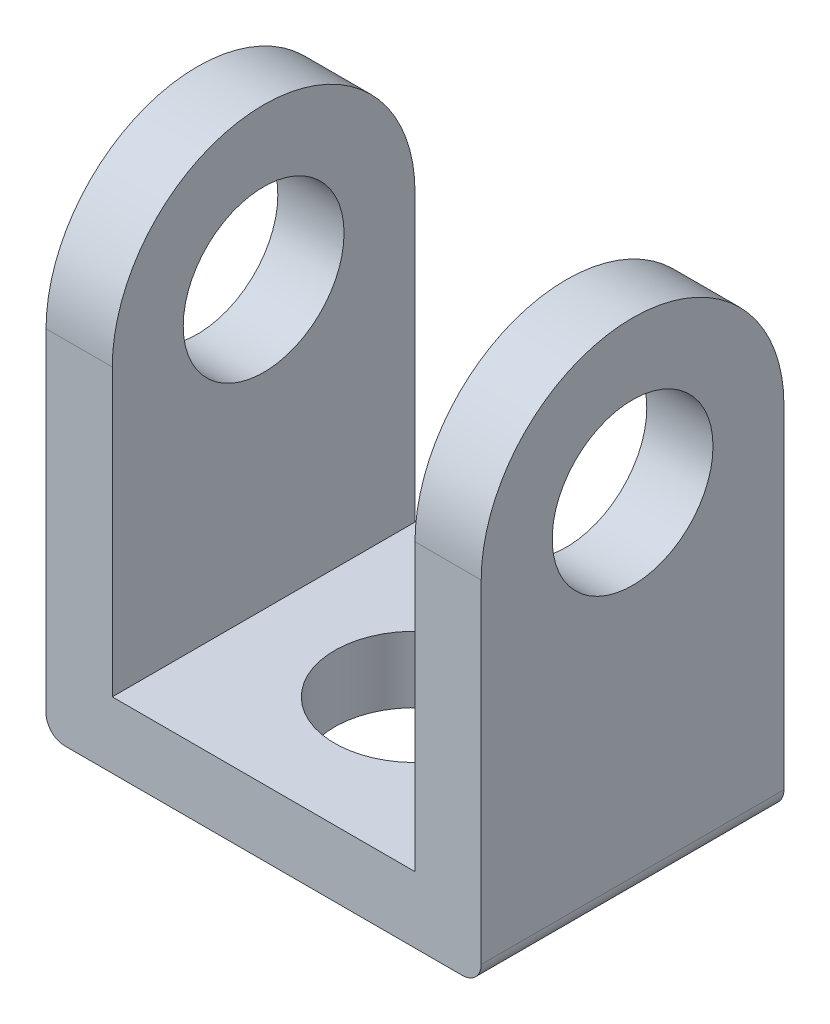
from build123d import *

# Parameters (mm, degrees)
SKETCH1_W           = 11.5
SKETCH1_H           = 8
BOSS_EXTRUDE1_DEPTH = 13.3
CUT_EXTRUDE1_REACH  = 20.032
SKETCH2_R           = 2.125
CUT_EXTRUDE2_REACH  = 20.032
CUT_EXTRUDE3_REACH  = 18.552
SKETCH4_W           = 8
SKETCH4_H           = 11.55
CUT_EXTRUDE4_REACH  = 17.032
SKETCH5_R           = 2.125
FILLET1_R           = 0.5


with BuildPart() as part:
    # Sketch1 → Boss-Extrude1 (new body)
    with BuildSketch(Plane(origin=(0, 0, 0), x_dir=(1, 0, 0), z_dir=(0, 1, 0))):
        Rectangle(SKETCH1_W, SKETCH1_H)
    extrude(amount=BOSS_EXTRUDE1_DEPTH)

    # Sketch2 → Cut-Extrude1 (cut, up to next)
    with BuildSketch(Plane(origin=(5.75, 0, 0), x_dir=(0, 0, -1), z_dir=(1, 0, 0)), mode=Mode.PRIVATE) as cut_extrude1_sk1:
        with Locations((0, 9.3)):
            Circle(SKETCH2_R)
    cut_extrude1_tool1 = extrude(cut_extrude1_sk1.sketch, amount=-CUT_EXTRUDE1_REACH, mode=Mode.PRIVATE) & part.part
    add(cut_extrude1_tool1.solids().sort_by_distance((5.75, 9.3, 0))[0], mode=Mode.SUBTRACT)

    # Sketch3 → Cut-Extrude2 (cut, up to next)
    with BuildSketch(Plane(origin=(5.75, 0, 0), x_dir=(0, 0, -1), z_dir=(1, 0, 0)), mode=Mode.PRIVATE) as cut_extrude2_sk1:
        with BuildLine():
            Line((0, 13.3), (-4, 13.3))
            Line((-4, 13.3), (-4, 9.3))
            ThreePointArc((-4, 9.3), (-2.828427125, 12.128427125), (0, 13.3))
        make_face()
    cut_extrude2_tool1 = extrude(cut_extrude2_sk1.sketch, amount=-CUT_EXTRUDE2_REACH, mode=Mode.PRIVATE) & part.part
    # Sketch3 → Cut-Extrude2 (cut, up to next)
    with BuildSketch(Plane(origin=(5.75, 0, 0), x_dir=(0, 0, -1), z_dir=(1, 0, 0)), mode=Mode.PRIVATE) as cut_extrude2_sk2:
        with BuildLine():
            Line((4, 13.3), (0, 13.3))
            ThreePointArc((0, 13.3), (2.828427125, 12.128427125), (4, 9.3))
            Line((4, 9.3), (4, 13.3))
        make_face()
    cut_extrude2_tool2 = extrude(cut_extrude2_sk2.sketch, amount=-CUT_EXTRUDE2_REACH, mode=Mode.PRIVATE) & part.part
    add(cut_extrude2_tool1.solids().sort_by_distance((5.75, 12.406528, 3.106528))[0], mode=Mode.SUBTRACT)
    add(cut_extrude2_tool2.solids().sort_by_distance((5.75, 12.406528, -3.106528))[0], mode=Mode.SUBTRACT)

    # Sketch4 → Cut-Extrude3 (cut, up to next)
    with BuildSketch(Plane.XY.offset(4), mode=Mode.PRIVATE) as cut_extrude3_sk1:
        with Locations((0, 7.525)):
            Rectangle(SKETCH4_W, SKETCH4_H)
    cut_extrude3_tool1 = extrude(cut_extrude3_sk1.sketch, amount=-CUT_EXTRUDE3_REACH, mode=Mode.PRIVATE) & part.part
    add(cut_extrude3_tool1.solids().sort_by_distance((0, 7.525, 4))[0], mode=Mode.SUBTRACT)

    # Sketch5 → Cut-Extrude4 (cut, up to next)
    with BuildSketch(Plane.XZ, mode=Mode.PRIVATE) as cut_extrude4_sk1:
        Circle(SKETCH5_R)
    cut_extrude4_tool1 = extrude(cut_extrude4_sk1.sketch, amount=-CUT_EXTRUDE4_REACH, mode=Mode.PRIVATE) & part.part
    add(cut_extrude4_tool1.solids().sort_by_distance((0, 0, 0))[0], mode=Mode.SUBTRACT)

    # Fillet1
    fillet1_edges = [part.edges().sort_by_distance(p)[0] for p in [
        (5.75, 0, 0),
        (-5.75, 0, 0),
    ]]
    fillet(fillet1_edges, radius=FILLET1_R)


solid = part.part
